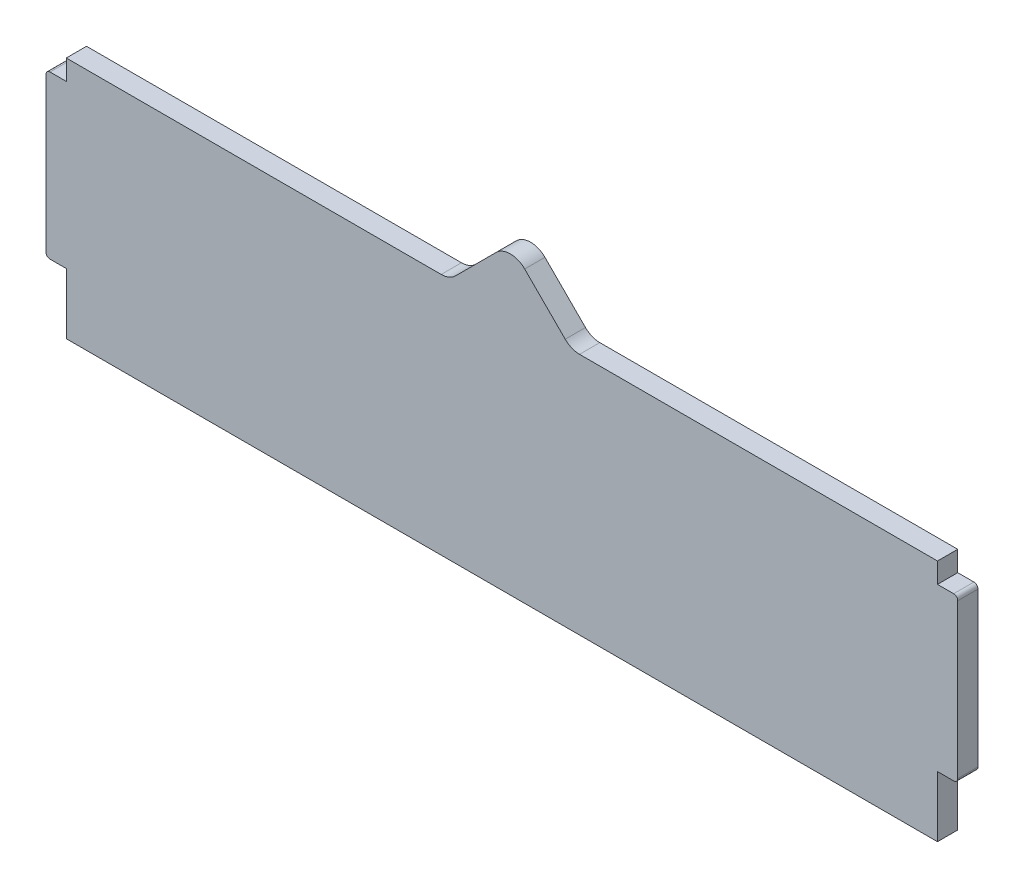
from build123d import *

# Parameters (mm, degrees)
BOSS_EXTRUDE1_DEPTH = 5
FILLET1_R           = 5
FILLET2_R           = 1


with BuildPart() as part:
    # Sketch1 → Boss-Extrude1 (new body)
    with BuildSketch(Plane.XY):
        Polygon((215, 55), (215, 60), (124.595635172, 60), (109.595635172, 75), (94.595635172, 60), (0, 60), (0, 55), (-5, 55), (-5, 15), (0, 15), (0, 0), (215, 0), (215, 15), (220, 15), (220, 55), align=None)
    extrude(amount=BOSS_EXTRUDE1_DEPTH)

    # Fillet1
    fillet1_edges = [part.edges().sort_by_distance(p)[0] for p in [
        (94.595635172, 60, 2.5),
        (124.595635172, 60, 2.5),
        (109.595635172, 75, 2.5),
    ]]
    fillet(fillet1_edges, radius=FILLET1_R)

    # Fillet2
    fillet2_edges = [part.edges().sort_by_distance(p)[0] for p in [
        (-5, 55, 2.5),
        (-5, 15, 2.5),
        (220, 15, 2.5),
        (220, 55, 2.5),
    ]]
    fillet(fillet2_edges, radius=FILLET2_R)


solid = part.part
